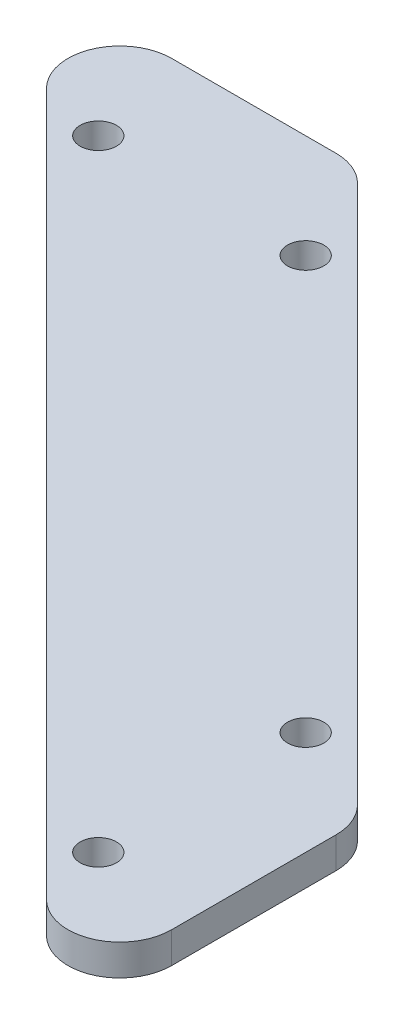
from build123d import *

# Parameters (mm, degrees)
BOSS_EXTRUDE1_DEPTH = 3
SKETCH2_R           = 1.75
CUT_EXTRUDE1_DEPTH  = 121.037494142
FILLET2_R           = 5


with BuildPart() as part:
    # Sketch1 → Boss-Extrude1 (new body)
    with BuildSketch(Plane(origin=(0, 0, 0), x_dir=(1, 0, 0), z_dir=(0, 1, 0))):
        Polygon((0, 0), (-84.852813742, 84.852813742), (-54.852813742, 84.852813742), (0, 30), align=None)
    extrude(amount=BOSS_EXTRUDE1_DEPTH)

    # Sketch2 → Cut-Extrude1 (cut, through all)
    with BuildSketch(Plane(origin=(0, 3, 0), x_dir=(1, 0, 0), z_dir=(0, 1, 0))):
        with Locations((-69.852813742, 74.852813742)):
            Circle(SKETCH2_R)
        with Locations((-49.852813742, 74.852813742)):
            Circle(SKETCH2_R)
        with Locations((-10, 15)):
            Circle(SKETCH2_R)
        with Locations((-10, 35)):
            Circle(SKETCH2_R)
    extrude(amount=-CUT_EXTRUDE1_DEPTH, mode=Mode.SUBTRACT)

    # Fillet2
    fillet2_edges = [part.edges().sort_by_distance(p)[0] for p in [
        (0, 1.5, 0),
        (0, 1.5, -30),
        (-54.852813742, 1.5, -84.852813742),
        (-84.852813742, 1.5, -84.852813742),
    ]]
    fillet(fillet2_edges, radius=FILLET2_R)


solid = part.part
